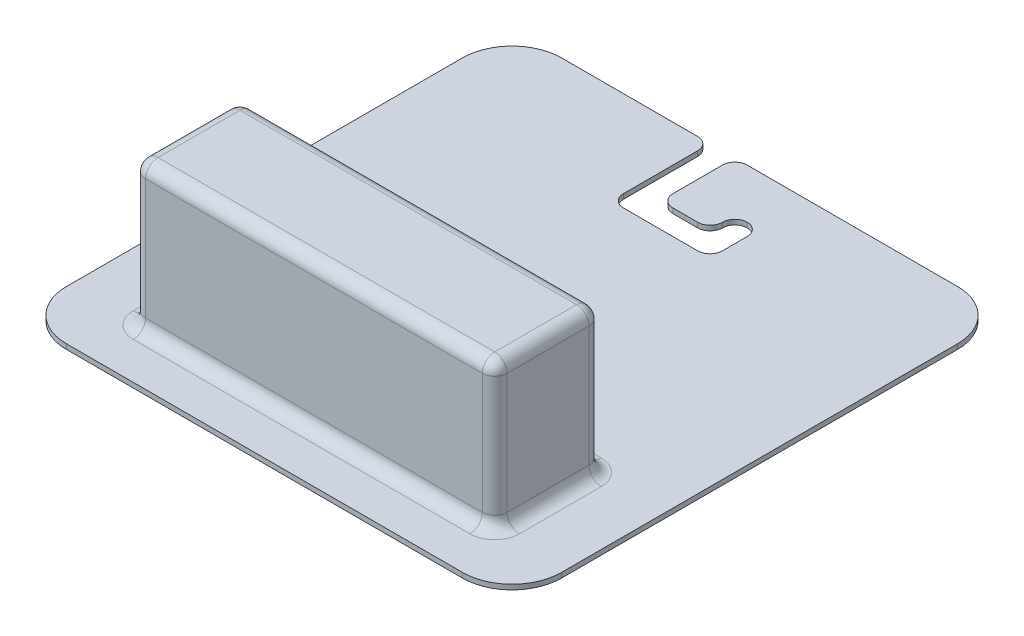
from build123d import *

# Parameters (mm, degrees)
SKETCH2_W               = 100
SKETCH2_H               = 100
BOSS_EXTRUDE1_DEPTH     = 1
FILLET1_R               = 10
CUT_EXTRUDE1_DEPTH      = 142.424891727
CUT_EXTRUDE1_DEPTH_BACK = 142.424891727
FILLET2_R               = 2.5
SKETCH4_W               = 73
SKETCH4_H               = 21.54
BOSS_EXTRUDE2_DEPTH     = 29.32
FILLET3_R               = 2.5


with BuildPart() as part:
    # Sketch2 → Boss-Extrude1 (new body)
    with BuildSketch(Plane(origin=(0, 0, 0), x_dir=(1, 0, 0), z_dir=(0, 1, 0))):
        with Locations((50, 50)):
            Rectangle(SKETCH2_W, SKETCH2_H)
    extrude(amount=BOSS_EXTRUDE1_DEPTH)

    # Fillet1
    fillet1_edges = [part.edges().sort_by_distance(p)[0] for p in [
        (0, 0.5, -100),
        (100, 0.5, -100),
        (100, 0.5, 0),
        (0, 0.5, 0),
    ]]
    fillet(fillet1_edges, radius=FILLET1_R)

    # Sketch3 → Cut-Extrude1 (cut, two sides: drawn at the far end of the back side and taken through both)
    with BuildSketch(Plane(origin=(0, 1, 0), x_dir=(1, 0, 0), z_dir=(0, 1, 0)).offset(-CUT_EXTRUDE1_DEPTH_BACK)):
        Polygon((40, 343.238075794), (40, 100), (40, 80), (60, 80), (60, 90), (55, 90), (55, 85), (45, 85), (45, 100), (45, 343.238075794), (45, 829.714227381), (40, 829.714227381), align=None)
    extrude(amount=CUT_EXTRUDE1_DEPTH + CUT_EXTRUDE1_DEPTH_BACK, mode=Mode.SUBTRACT)

    # Fillet2
    fillet2_edges = [part.edges().sort_by_distance(p)[0] for p in [
        (60, 0.5, -80),
        (60, 0.5, -90),
        (55, 0.5, -90),
        (40, 0.5, -80),
    ]]
    fillet(fillet2_edges, radius=FILLET2_R - 0.0001)  # a hair under: the kernel refuses the full size
    fillet2_2_edges = [part.edges().sort_by_distance(p)[0] for p in [
        (45, 0.5, -100),
        (40, 0.5, -100),
        (55, 0.5, -85),
        (45, 0.5, -85),
    ]]
    fillet(fillet2_2_edges, radius=FILLET2_R)

    # Sketch4 → Boss-Extrude2 (add)
    with BuildSketch(Plane(origin=(0, 1, 0), x_dir=(1, 0, 0), z_dir=(0, 1, 0))):
        with Locations((50, 20.77)):
            Rectangle(SKETCH4_W, SKETCH4_H)
    extrude(amount=BOSS_EXTRUDE2_DEPTH)

    # Fillet3
    fillet3_edges = [part.edges().sort_by_distance(p)[0] for p in [
        (13.5, 1, -20.77),
        (13.5, 15.66, -31.54),
        (50, 1, -10),
        (13.5, 15.66, -10),
        (86.5, 1, -20.77),
        (86.5, 15.66, -10),
        (50, 1, -31.54),
        (86.5, 15.66, -31.54),
        (13.5, 30.32, -20.77),
        (50, 30.32, -10),
        (86.5, 30.32, -20.77),
        (50, 30.32, -31.54),
    ]]
    fillet(fillet3_edges, radius=FILLET3_R)


solid = part.part
